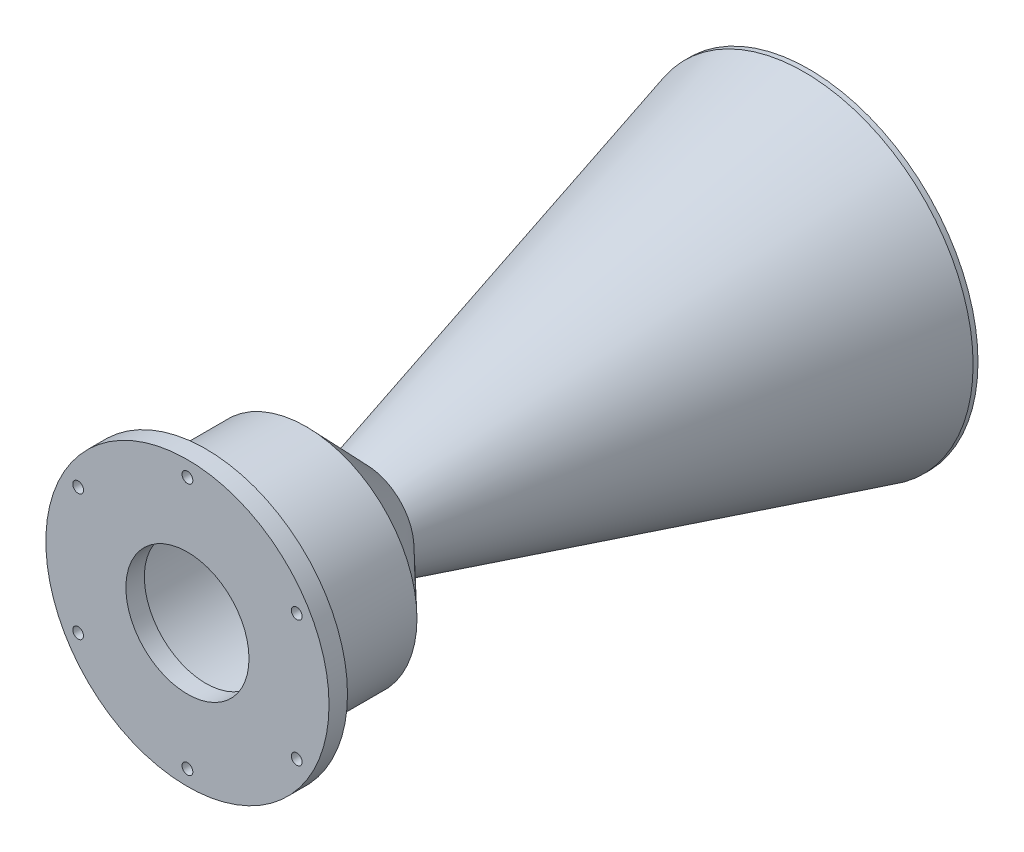
from build123d import *

# Parameters (mm, degrees)
SKETCH2_R               = 0.875
BOLT_HOLE_DEPTH         = 3
BOLT_HOLE_PATTERN_COUNT = 6


with BuildPart() as part:
    # Nozzle base structure → Revolve1 (revolve)
    with BuildSketch(Plane(origin=(0, 0, 0), x_dir=(0, 0, -1), z_dir=(1, 0, 0)), mode=Mode.PRIVATE) as revolve1_sk:
        Polygon((0, 4.5), (72.97, 24.553), (72.97, 27.445755495), (72.175037331, 27.445755495), (0.935060955, 7.868185997), (-8.714285714, 18), (-25, 18), (-25, 23), (-28, 23), (-28, 18), (-28, 10), (-25, 10), (-25, 15), (-10, 15), align=None)
    revolve(revolve1_sk.sketch.rotate(Axis((0, 0, 0), (0, 0, -1)), 90), axis=Axis((0, 0, 0), (0, 0, -1)))

    # Throat
    # a fillet whose section is not a circle: 10 mm, written as the material it takes off along each edge
    with BuildSketch(Plane(origin=(0, 0, 0), x_dir=(1, 0, 0), z_dir=(0, 1, 0))) as throat_piece_1:
        with BuildLine():
            Bezier((6.08476834, 5.766745413), (4.5, 0), (8.830734933, -4.12450946), weights=[1, 1.857142857, 1])
            Line((8.830734933, -4.12450946), (4.5, 0))
            Line((4.5, 0), (6.08476834, 5.766745413))
        make_face()
    revolve(axis=Axis((0, 0, 0), (0, 0, -1)), mode=Mode.SUBTRACT)

    # Sketch2 → Bolt hole (cut)
    with BuildSketch(Plane(origin=(0, 0, 25), x_dir=(-1, 0, 0), z_dir=(0, 0, -1))):
        with Locations((0, 20.5)):
            Circle(SKETCH2_R)
    bolt_hole = extrude(amount=-BOLT_HOLE_DEPTH, mode=Mode.SUBTRACT)

    # Bolt hole pattern: Bolt hole ×6 about axis
    bolt_hole_pattern_axis = Axis((0, 0, 0), (0, 0, 1))
    for i in range(1, BOLT_HOLE_PATTERN_COUNT):
        add(bolt_hole.rotate(bolt_hole_pattern_axis, i * 360 / BOLT_HOLE_PATTERN_COUNT), mode=Mode.SUBTRACT)


solid = part.part
